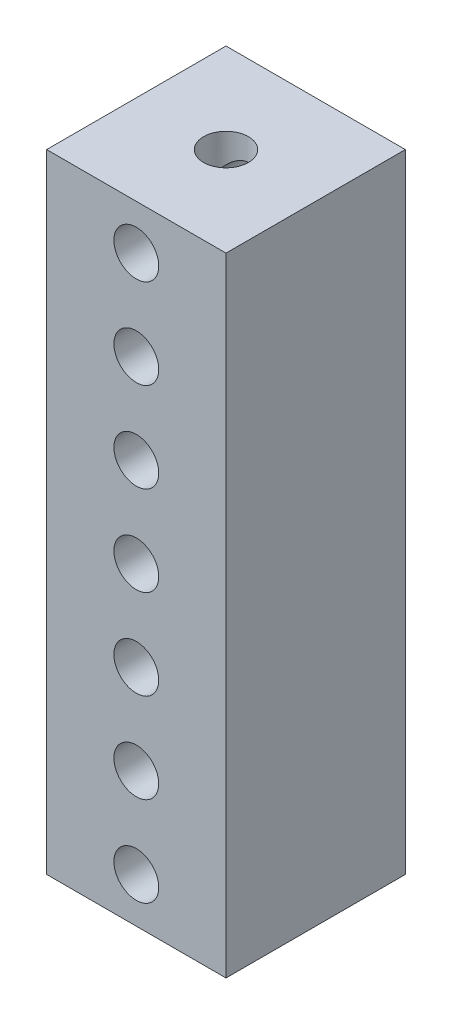
from build123d import *

# Parameters (mm, degrees)
SKETCH1_W           = 20
SKETCH1_H           = 20
SKETCH1_R           = 2.5
BOSS_EXTRUDE1_DEPTH = 70
SKETCH2_R           = 2.5
CUT_EXTRUDE1_DEPTH  = 100
LPATTERN1_COUNT     = 5
LPATTERN1_PITCH     = 10
SKETCH3_R           = 2.5
CUT_EXTRUDE4_DEPTH  = 74.484692283


with BuildPart() as part:
    # Sketch1 → Boss-Extrude1 (new body)
    with BuildSketch(Plane(origin=(0, 0, 0), x_dir=(1, 0, 0), z_dir=(0, 1, 0))):
        Rectangle(SKETCH1_W, SKETCH1_H)
        Circle(SKETCH1_R, mode=Mode.SUBTRACT)
    extrude(amount=BOSS_EXTRUDE1_DEPTH)

    # Sketch2 → Cut-Extrude1 (cut)
    with BuildSketch(Plane.XY.offset(10)):
        with Locations((0, 5)):
            Circle(SKETCH2_R)
    cut_extrude1 = extrude(amount=-CUT_EXTRUDE1_DEPTH, mode=Mode.SUBTRACT)

    # LPattern1: Cut-Extrude1 ×5
    with Locations(*[(0, i * LPATTERN1_PITCH, 0) for i in range(1, LPATTERN1_COUNT)]):
        add(cut_extrude1, mode=Mode.SUBTRACT)

    # Sketch3 → Cut-Extrude4 (cut, through all)
    with BuildSketch(Plane.XY.offset(10)):
        with Locations((0, 65)):
            Circle(SKETCH3_R)
        with Locations((0, 55)):
            Circle(SKETCH3_R)
    extrude(amount=-CUT_EXTRUDE4_DEPTH, mode=Mode.SUBTRACT)


solid = part.part
